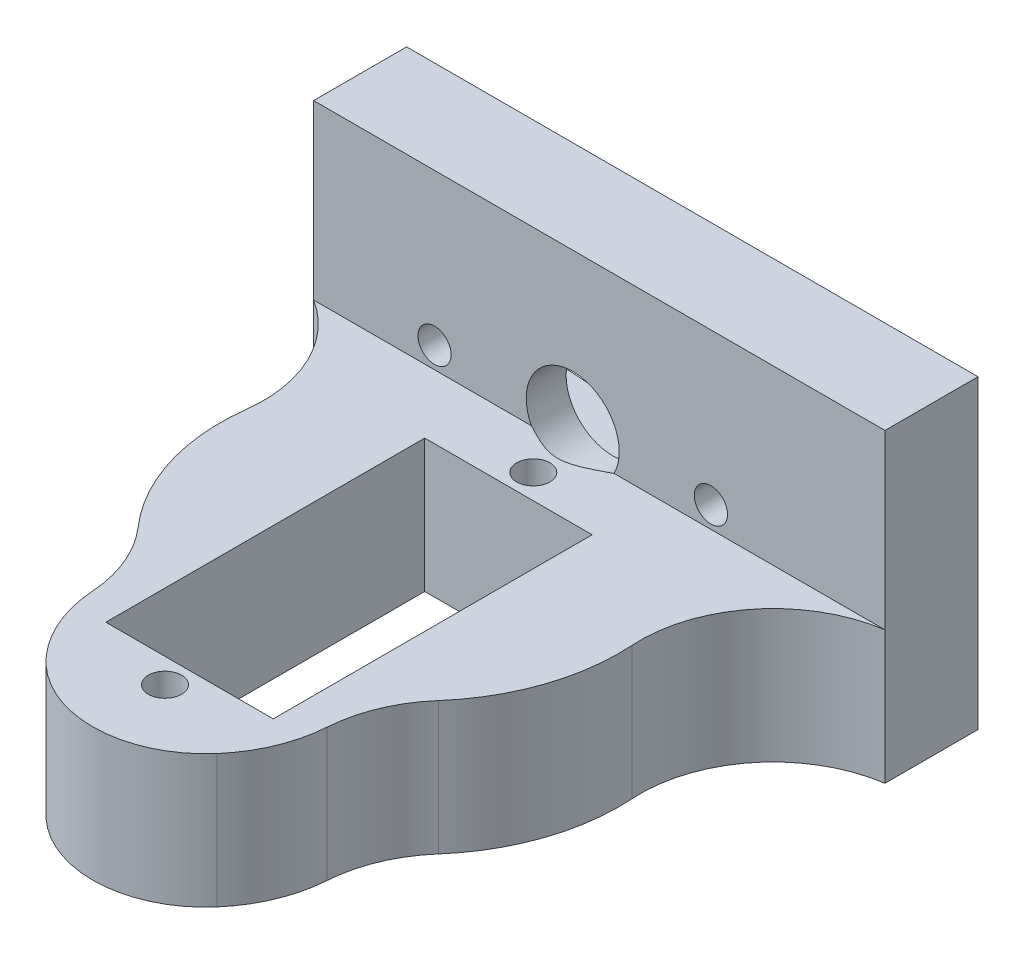
from build123d import *

# Parameters (mm, degrees)
SKETCH1_W                 = 43
SKETCH1_H                 = 23
BOSS_EXTRUDE1_DEPTH       = 7
BOSS_EXTRUDE2_DEPTH       = 10
CUT_EXTRUDE1_DEPTH        = 4
M8X1_0_TAPPED_HOLE1_D     = 7
M8X1_0_TAPPED_HOLE1_DEPTH = 3
M8X1_0_TAPPED_HOLE1_TIP   = 2.103012167
M3X0_5_TAPPED_HOLE1_D     = 2.5
SKETCH10_W                = 24
SKETCH10_H                = 12.6
CUT_EXTRUDE2_DEPTH        = 65.606711792
M3X0_5_TAPPED_HOLE2_D     = 2.5
M3X0_5_TAPPED_HOLE2_DEPTH = 7.748924226
M3X0_5_TAPPED_HOLE2_TIP   = 0.751075774
FILLET2_R                 = 10
FILLET3_R                 = 10
FILLET4_R                 = 8.5


with BuildPart() as part:
    # Sketch1 → Boss-Extrude1 (new body)
    with BuildSketch(Plane.XY):
        with Locations((-2.787, -0.099880638)):
            Rectangle(SKETCH1_W, SKETCH1_H)
    extrude(amount=BOSS_EXTRUDE1_DEPTH)

    # Sketch9 → Boss-Extrude2 (add)
    with BuildSketch(Plane(origin=(-10, -11.599880638, 0), x_dir=(0, 0, 1), z_dir=(0, 1, 0))):
        with BuildLine():
            Line((43.646910996, 14.033226444), (35.00321795, 14.033226444))
            ThreePointArc((35.00321795, 14.033226444), (31.483591553, 14.673085952), (28.414378439, 16.510780439))
            ThreePointArc((28.414378439, 16.510780439), (3.5, 5.213), (28.414378439, -6.084780439))
            ThreePointArc((28.414378439, -6.084780439), (31.483591553, -4.247085952), (35.00321795, -3.607226444))
            Line((35.00321795, -3.607226444), (43.646910996, -3.607226444))
            Line((43.646910996, -3.607226444), (43.646910996, 14.033226444))
        make_face()
    extrude(amount=BOSS_EXTRUDE2_DEPTH)

    # Sketch2 → Cut-Extrude1 (cut)
    with BuildSketch(Plane(origin=(0, 0, 0), x_dir=(-1, 0, 0), z_dir=(0, 0, -1))):
        with BuildLine():
            Line((1.32735088, -3.862748758), (4.494142857, -4.089527441))
            ThreePointArc((4.494142857, -4.089527441), (4.787, -4.1), (5.079857143, -4.089527441))
            Line((5.079857143, -4.089527441), (8.24664912, -3.862748758))
            Line((8.24664912, -3.862748758), (20.401285714, -2.992337152))
            ThreePointArc((20.401285714, -2.992337152), (23.187, 0), (20.401285714, 2.992337152))
            Line((20.401285714, 2.992337152), (8.24664912, 3.862748758))
            Line((8.24664912, 3.862748758), (5.079857143, 4.089527441))
            ThreePointArc((5.079857143, 4.089527441), (4.787, 4.1), (4.494142857, 4.089527441))
            Line((4.494142857, 4.089527441), (1.32735088, 3.862748758))
            Line((1.32735088, 3.862748758), (-10.827285714, 2.992337152))
            ThreePointArc((-10.827285714, 2.992337152), (-13.613, 0), (-10.827285714, -2.992337152))
            Line((-10.827285714, -2.992337152), (1.32735088, -3.862748758))
        make_face()
    extrude(amount=-CUT_EXTRUDE1_DEPTH, mode=Mode.SUBTRACT)

    # M8x1.0 Tapped Hole1
    with Locations(Plane(origin=(0, 0, 4), x_dir=(-1, 0, 0), z_dir=(0, 0, -1))):
        with Locations((4.787, 0)):
            Hole(M8X1_0_TAPPED_HOLE1_D / 2, depth=M8X1_0_TAPPED_HOLE1_DEPTH)
            with Locations((0, 0, -(M8X1_0_TAPPED_HOLE1_DEPTH + M8X1_0_TAPPED_HOLE1_TIP / 2))):  # 118° drill point
                Cone(0, M8X1_0_TAPPED_HOLE1_D / 2, M8X1_0_TAPPED_HOLE1_TIP, mode=Mode.SUBTRACT)

    # M3x0.5 Tapped Hole1 (through all)
    with Locations(Plane(origin=(0, 0, 4), x_dir=(-1, 0, 0), z_dir=(0, 0, -1))):
        with Locations((15.187, 0), (-5.613, 0), (4.787, 0)):
            Hole(M3X0_5_TAPPED_HOLE1_D / 2)

    # Sketch10 → Cut-Extrude2 (cut, through all)
    with BuildSketch(Plane(origin=(-23, -11.599880638, 0), x_dir=(0, 0, -1), z_dir=(0, 1, 0))):
        with Locations((-23.818759101, -18.192773556)):
            Rectangle(SKETCH10_W, SKETCH10_H)
    extrude(amount=CUT_EXTRUDE2_DEPTH, mode=Mode.SUBTRACT)

    # M3x0.5 Tapped Hole2
    with Locations(Plane(origin=(-13, -1.599880638, 0), x_dir=(0, 0, -1), z_dir=(0, 1, 0))):
        with Locations((-37.668759101, -8.192773556), (-9.968759101, -8.213)):
            Hole(M3X0_5_TAPPED_HOLE2_D / 2, depth=M3X0_5_TAPPED_HOLE2_DEPTH)
            with Locations((0, 0, -(M3X0_5_TAPPED_HOLE2_DEPTH + M3X0_5_TAPPED_HOLE2_TIP / 2))):  # 118° drill point
                Cone(0, M3X0_5_TAPPED_HOLE2_D / 2, M3X0_5_TAPPED_HOLE2_TIP, mode=Mode.SUBTRACT)

    # Fillet2
    # the kernel refuses this fillet: 10 mm, written as the material it adds along each edge
    with BuildSketch(Plane(origin=(4.850495199, -1.599880638, 7), x_dir=(1, 0, 0), z_dir=(0, -1, 0))) as fillet2_piece_1:
        with BuildLine():
            CenterArc((15.328319752, 9.891985975), FILLET2_R, 176.271875941, 85.299253253)
            Line((5.349481533, 10.542207323), (5.149904768, 10.55521175))
            ThreePointArc((5.149904768, 10.55521175), (3.577273835, 4.813127088), (-0.128339434, 0.153391622))
            Line((-0.128339434, 0.153391622), (0, -0.2))
            ThreePointArc((0, -0.2), (6.931252401, -0.2), (13.833188502, -0.19783972))
            Line((13.833188502, -0.19783972), (13.862504801, 0))
        make_face()
    extrude(amount=10)
    with BuildSketch(Plane(origin=(-14.424495199, -1.599880638, 7), x_dir=(-1, 0, 0), z_dir=(0, -1, 0))) as fillet2_piece_2:
        with BuildLine():
            CenterArc((15.193634372, -8.460440739), FILLET2_R, 122.216027092, 64.805428204)
            Line((5.26862991, -9.682850831), (5.070129821, -9.707299033))
            ThreePointArc((5.070129821, -9.707299033), (3.379125123, -4.436159529), (-0.128339434, -0.153391622))
            Line((-0.128339434, -0.153391622), (0, 0.2))
            ThreePointArc((0, 0.2), (4.931252401, 0.2), (9.75588221, 0.169208815))
            Line((9.75588221, 0.169208815), (9.862504801, 0))
        make_face()
    extrude(amount=10)

    # Fillet3
    # the kernel refuses this fillet: 10 mm, written as the material it takes off along each edge
    with BuildSketch(Plane(origin=(-13.607226444, -36.484775111, 43.646910996), x_dir=(1, 0, 0), z_dir=(0, 1, 0))) as fillet3_piece_1:
        with BuildLine():
            CenterArc((9.953957789, 10), FILLET3_R, 183.8885176, 86.1114824)
            Line((-0.023021105, 9.321846523), (-1.020718995, 9.254031175))
            ThreePointArc((-1.020718995, 9.254031175), (-1, 8.643693046), (-1, 0))
            Line((-1, 0), (0, -1))
            Line((0, -1), (9.953957789, -1))
            Line((9.953957789, -1), (9.953957789, 0))
        make_face()
    extrude(amount=59.769788945, mode=Mode.SUBTRACT)
    with BuildSketch(Plane(origin=(4.033226444, -36.484775111, 43.646910996), x_dir=(0.0024695788781197194, 0, -0.9999969505854329), z_dir=(0, 1, 0))) as fillet3_piece_2:
        with BuildLine():
            CenterArc((9.975387422, 9.978623224), FILLET3_R, 180.141496591, 86.1114824)
            Line((-0.024582084, 9.953927435), (-1.024579034, 9.951457856))
            Line((-1.024579034, 9.951457856), (-0.999996951, -0.002469579))
            Line((-0.999996951, -0.002469579), (0.002469579, -0.999996951))
            ThreePointArc((0.002469579, -0.999996951), (8.646136267, -0.978650669), (9.256523702, -0.997862322))
            Line((9.256523702, -0.997862322), (9.321874949, 0))
        make_face()
    extrude(amount=59.769788945, mode=Mode.SUBTRACT)

    # Fillet4
    fillet4_edges = [part.edges().sort_by_distance(p)[0] for p in [
        (-4.787, -6.599880638, 43.582435806),
    ]]
    fillet(fillet4_edges, radius=FILLET4_R)


solid = part.part
